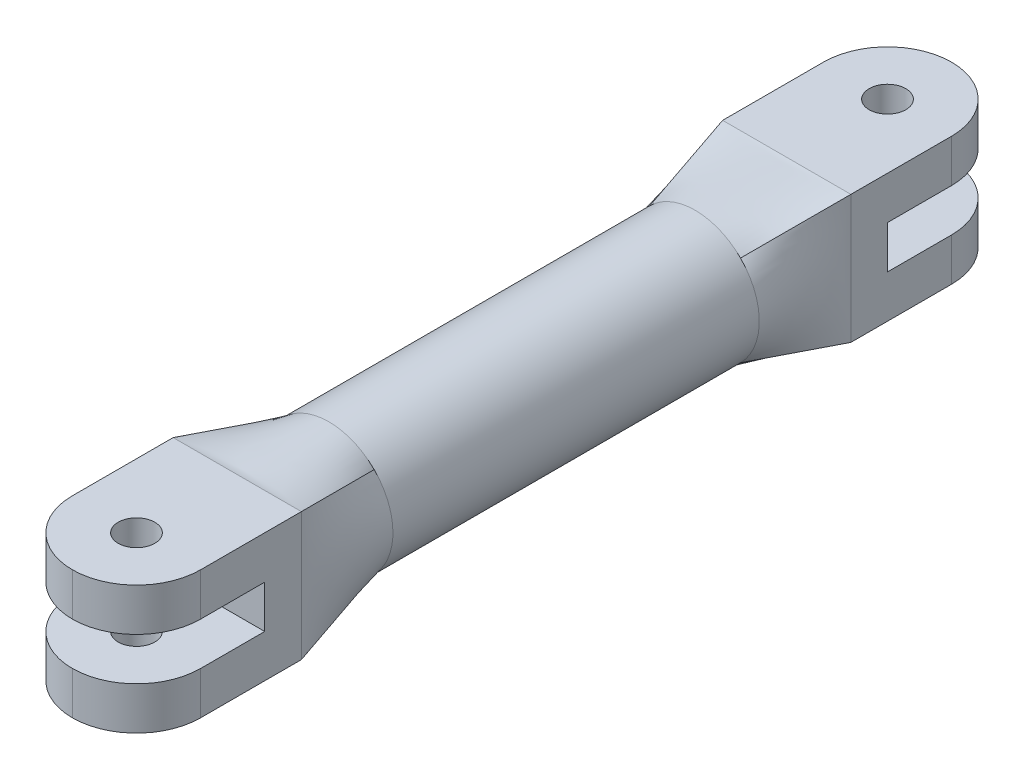
from build123d import *

# Parameters (mm, degrees)
SKETCH1_R           = 3.5
BOSS_EXTRUDE1_DEPTH = 20
SKETCH3_2_W         = 7
SKETCH3_2_H         = 7
BOSS_EXTRUDE3_DEPTH = 2
SKETCH4_W           = 7
SKETCH4_H           = 2.333333333
BOSS_EXTRUDE2_DEPTH = 7
SKETCH5_R           = 1
CUT_EXTRUDE1_DEPTH  = 35.889110176
FILLET1_R           = 3.5


with BuildPart() as part:
    # Sketch1 → Boss-Extrude1 (new body)
    with BuildSketch(Plane.XY):
        Circle(SKETCH1_R)
    extrude(amount=-BOSS_EXTRUDE1_DEPTH)

    # Loft1: read off the stored shape, not the designer's step
    # Loft1: loft between two sections, ruled curve by curve
    loft1_from = [
        Edge.make_bspline([(-3.5, 3.5, -25), (-3.5, 2.916666667, -25), (-3.5, 2.333333333, -25), (-3.5, 1.166666667, -25), (-3.5, 0.583333333, -25), (-3.5, -0.583333333, -25), (-3.5, -1.166666667, -25), (-3.5, -2.333333333, -25), (-3.5, -2.916666667, -25), (-3.5, -3.5, -25)], [0, 0, 0, 0, 0.25, 0.25, 0.5, 0.5, 0.75, 0.75, 1, 1, 1, 1], 3),
        Edge.make_bspline([(-3.5, -3.5, -25), (-2.916666667, -3.5, -25), (-2.333333333, -3.5, -25), (-1.166666667, -3.5, -25), (-0.583333333, -3.5, -25), (0.583333333, -3.5, -25), (1.166666667, -3.5, -25), (2.333333333, -3.5, -25), (2.916666667, -3.5, -25), (3.5, -3.5, -25)], [0, 0, 0, 0, 0.25, 0.25, 0.5, 0.5, 0.75, 0.75, 1, 1, 1, 1], 3),
        Edge.make_bspline([(3.5, 3.5, -25), (2.916666667, 3.5, -25), (2.333333333, 3.5, -25), (1.166666667, 3.5, -25), (0.583333333, 3.5, -25), (-0.583333333, 3.5, -25), (-1.166666667, 3.5, -25), (-2.333333333, 3.5, -25), (-2.916666667, 3.5, -25), (-3.5, 3.5, -25)], [0, 0, 0, 0, 0.25, 0.25, 0.5, 0.5, 0.75, 0.75, 1, 1, 1, 1], 3),
        Edge.make_bspline([(3.5, -3.5, -25), (3.5, -2.916666667, -25), (3.5, -2.333333333, -25), (3.5, -1.166666667, -25), (3.5, -0.583333333, -25), (3.5, 0.583333333, -25), (3.5, 1.166666667, -25), (3.5, 2.333333333, -25), (3.5, 2.916666667, -25), (3.5, 3.5, -25)], [0, 0, 0, 0, 0.25, 0.25, 0.5, 0.5, 0.75, 0.75, 1, 1, 1, 1], 3),
    ]
    loft1_to = [
        Edge.make_bspline([(-2.474873734, 2.474873734, -20), (-2.766540401, 2.183207067, -20), (-3.028055087, 1.815378049, -20), (-3.396138059, 0.964863384, -20), (-3.5, 0.483249156, -20), (-3.5, -0.483249156, -20), (-3.396138059, -0.964863384, -20), (-3.028055087, -1.815378049, -20), (-2.766540401, -2.183207067, -20), (-2.474873734, -2.474873734, -20)], [0, 0, 0, 0, 0.25, 0.25, 0.5, 0.5, 0.75, 0.75, 1, 1, 1, 1], 3),
        Edge.make_bspline([(-2.474873734, -2.474873734, -20), (-2.183207067, -2.766540401, -20), (-1.815378049, -3.028055087, -20), (-0.964863384, -3.396138059, -20), (-0.483249156, -3.5, -20), (0.483249156, -3.5, -20), (0.964863384, -3.396138059, -20), (1.815378049, -3.028055087, -20), (2.183207067, -2.766540401, -20), (2.474873734, -2.474873734, -20)], [0, 0, 0, 0, 0.25, 0.25, 0.5, 0.5, 0.75, 0.75, 1, 1, 1, 1], 3),
        Edge.make_bspline([(2.474873734, 2.474873734, -20), (2.183207067, 2.766540401, -20), (1.815378049, 3.028055087, -20), (0.964863384, 3.396138059, -20), (0.483249156, 3.5, -20), (-0.483249156, 3.5, -20), (-0.964863384, 3.396138059, -20), (-1.815378049, 3.028055087, -20), (-2.183207067, 2.766540401, -20), (-2.474873734, 2.474873734, -20)], [0, 0, 0, 0, 0.25, 0.25, 0.5, 0.5, 0.75, 0.75, 1, 1, 1, 1], 3),
        Edge.make_bspline([(2.474873734, -2.474873734, -20), (2.766540401, -2.183207067, -20), (3.028055087, -1.815378049, -20), (3.396138059, -0.964863384, -20), (3.5, -0.483249156, -20), (3.5, 0.483249156, -20), (3.396138059, 0.964863384, -20), (3.028055087, 1.815378049, -20), (2.766540401, 2.183207067, -20), (2.474873734, 2.474873734, -20)], [0, 0, 0, 0, 0.25, 0.25, 0.5, 0.5, 0.75, 0.75, 1, 1, 1, 1], 3),
    ]
    loft1 = Solid(Shell([*[Face.make_surface_from_curves(loft1_from[k], loft1_to[k]) for k in range(4)], Face(Wire(loft1_from)), Face(Wire(loft1_to))]))
    add(loft1)

    # Sketch3<2> → Boss-Extrude3 (add)
    with BuildSketch(Plane(origin=(0, 0, -25), x_dir=(-1, 0, 0), z_dir=(0, 0, -1))):
        Rectangle(SKETCH3_2_W, SKETCH3_2_H)
    extrude(amount=BOSS_EXTRUDE3_DEPTH)

    # Sketch4 → Boss-Extrude2 (add)
    with BuildSketch(Plane(origin=(0, 0, -27), x_dir=(-1, 0, 0), z_dir=(0, 0, -1))):
        with Locations((0, 2.333333334)):
            Rectangle(SKETCH4_W, SKETCH4_H)
        with Locations((0, -2.333333334)):
            Rectangle(SKETCH4_W, SKETCH4_H)
    extrude(amount=BOSS_EXTRUDE2_DEPTH)

    # Sketch5 → Cut-Extrude1 (cut, through all)
    with BuildSketch(Plane(origin=(0, 3.5, 0), x_dir=(1, 0, 0), z_dir=(0, 1, 0))):
        with Locations(Location((0, 30.5, 0), (0, 0, 270))):
            Circle(SKETCH5_R)
    extrude(amount=-CUT_EXTRUDE1_DEPTH, mode=Mode.SUBTRACT)

    # Fillet1
    fillet1_edges = [part.edges().sort_by_distance(p)[0] for p in [
        (-3.5, 2.333333333, -34),
        (-3.5, -2.333333333, -34),
        (3.5, -2.333333333, -34),
        (3.5, 2.333333333, -34),
    ]]
    fillet(fillet1_edges, radius=FILLET1_R - 0.0001)  # a hair under: the kernel refuses the full size

    # Mirror1: part across plane


with BuildPart() as part_1:
    add(part.part)
    add(part.part.mirror(Plane.XY.offset(-10)))


solid = part_1.part
